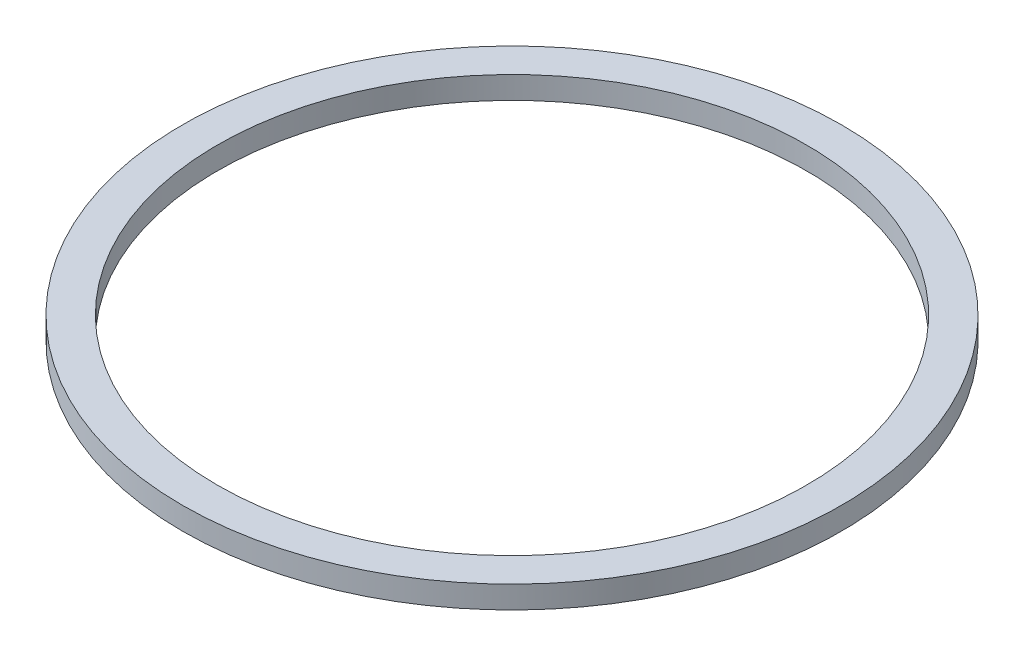
from build123d import *

# Parameters (mm, degrees)
SKETCH1_R           = 125
SKETCH1_R_2         = 111.75
BOSS_EXTRUDE1_DEPTH = 8.5


with BuildPart() as part:
    # Sketch1 → Boss-Extrude1 (new body)
    with BuildSketch(Plane(origin=(0, 0, 0), x_dir=(1, 0, 0), z_dir=(0, 1, 0))):
        Circle(SKETCH1_R)
        Circle(SKETCH1_R_2, mode=Mode.SUBTRACT)
    extrude(amount=BOSS_EXTRUDE1_DEPTH)


solid = part.part
